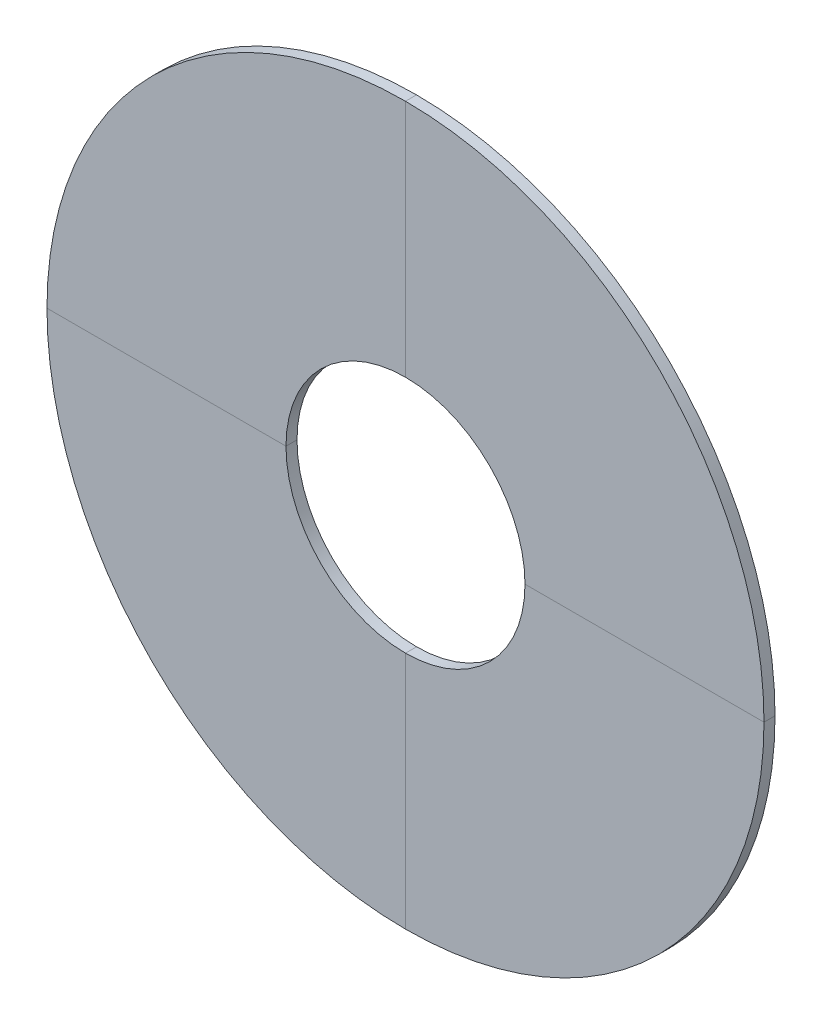
from build123d import *

# Parameters (mm, degrees)
SKETCH1_W          = 6
SKETCH1_H          = 130
SKETCH3_W          = 6
SKETCH3_H          = 390
SPLIT2_OUTLINE_W   = 196
SPLIT2_OUTLINE_H   = 6
SPLIT2_DEPTH       = 195
SPLIT2_START       = -3
SPLIT2_2_DEPTH     = 6
SPLIT2_3_OUTLINE_W = 196
SPLIT2_3_OUTLINE_H = 6
SPLIT2_3_DEPTH     = 195
SPLIT2_4_DEPTH     = 6


# Read off the part's stored shape, not the designer's step: Split2
with BuildPart() as part:
    # Sketch1 → Revolve1 (revolve)
    with BuildSketch(Plane(origin=(0, 0, 0), x_dir=(0, 0, -1), z_dir=(1, 0, 0)), mode=Mode.PRIVATE) as revolve1_sk:
        with Locations((0, 130)):
            Rectangle(SKETCH1_W, SKETCH1_H)
    revolve(revolve1_sk.sketch.rotate(Axis((0, 0, 3), (0, 0, -1)), 180), axis=Axis((0, 0, 3), (0, 0, -1)))


with BuildPart() as body_2:
    # Split1: the piece behind the surface
    add(part.part)
    # Sketch3 → Surface-Plane1: a flat surface bounded by the sketch
    with BuildSketch(Plane(origin=(0, 0, 0), x_dir=(0, 0, -1), z_dir=(1, 0, 0)), mode=Mode.PRIVATE) as surface_plane1_1_region:
        Rectangle(SKETCH3_W, SKETCH3_H)
    surface_plane1_1 = surface_plane1_1_region.sketch.faces()[0]
    split(bisect_by=surface_plane1_1, keep=Keep.BOTTOM)

    # Split2 outline → Split2 (cut)
    with BuildSketch(Plane(origin=(0, 0, 0), x_dir=(1, 0, 0), z_dir=(0, 1, 0))):
        with Locations((-98, 0)):
            Rectangle(SPLIT2_OUTLINE_W, SPLIT2_OUTLINE_H)
    extrude(amount=SPLIT2_DEPTH, mode=Mode.SUBTRACT)


with BuildPart() as part_1:
    add(part.part)

    # Split1: split by a surface, the side it looks to stays
    # Sketch3 → Surface-Plane1: a flat surface bounded by the sketch
    with BuildSketch(Plane(origin=(0, 0, 0), x_dir=(0, 0, -1), z_dir=(1, 0, 0)), mode=Mode.PRIVATE) as surface_plane1_2_region:
        Rectangle(SKETCH3_W, SKETCH3_H)
    surface_plane1_2 = surface_plane1_2_region.sketch.faces()[0]
    split(bisect_by=surface_plane1_2, keep=Keep.TOP)

    # Split2 3 outline → Split2 3 (cut)
    with BuildSketch(Plane(origin=(0, 0, 0), x_dir=(1, 0, 0), z_dir=(0, 1, 0))):
        with Locations((98, 0)):
            Rectangle(SPLIT2_3_OUTLINE_W, SPLIT2_3_OUTLINE_H)
    extrude(amount=SPLIT2_3_DEPTH, mode=Mode.SUBTRACT)


with BuildPart() as body_3:
    # Split2 2 outline → Split2 2 (new body)
    with BuildSketch(Plane.XY.offset(SPLIT2_START)):
        with BuildLine():
            Line((-195, 0), (-65, 0))
            ThreePointArc((-65, 0), (-45.961940777, 45.961940777), (0, 65))
            Line((0, 65), (0, 195))
            ThreePointArc((0, 195), (-137.885822331, 137.885822331), (-195, 0))
        make_face()
    extrude(amount=SPLIT2_2_DEPTH)


with BuildPart() as body_4:
    # Split2 4 outline → Split2 4 (new body)
    with BuildSketch(Plane.XY.offset(SPLIT2_START)):
        with BuildLine():
            Line((65, 0), (195, 0))
            ThreePointArc((195, 0), (137.885822331, 137.885822331), (0, 195))
            Line((0, 195), (0, 65))
            ThreePointArc((0, 65), (45.961940777, 45.961940777), (65, 0))
        make_face()
    extrude(amount=SPLIT2_4_DEPTH)


solid = Compound([body_2.part, part_1.part, body_3.part, body_4.part])
